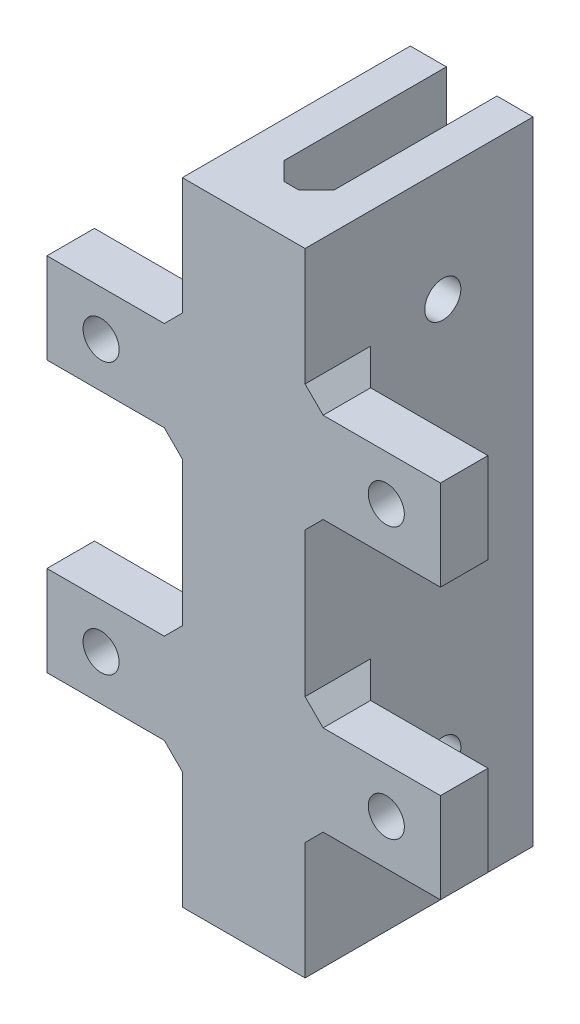
from build123d import *

# Parameters (mm, degrees)
BOSS_EXTRUDE1_DEPTH     = 70
CUT_EXTRUDE1_DEPTH      = 78.776388862
CUT_EXTRUDE1_DEPTH_BACK = 78.776388862
SKETCH2_R               = 2
SKETCH2_W               = 15
SKETCH2_H               = 15
SKETCH2_H_2             = 20
CUT_EXTRUDE2_DEPTH      = 79.217389371
CUT_EXTRUDE2_DEPTH_BACK = 79.217389371
SKETCH3_R               = 2
CHAMFER1_SIZE           = 2


with BuildPart() as part:
    # Sketch1 → Boss-Extrude1 (new body)
    with BuildSketch(Plane(origin=(0, 0, 0), x_dir=(1, 0, 0), z_dir=(0, 1, 0))):
        Polygon((-16.229090909, 0), (-1.229090909, 0), (-1.229090909, 20), (2.770909091, 20), (2.770909091, 0), (8.370909091, 0), (8.370909091, 20), (12.370909091, 20), (12.370909091, 0), (27.370909091, 0), (27.370909091, -5.261218749), (-16.229090909, -5.261218749), align=None)
    extrude(amount=BOSS_EXTRUDE1_DEPTH)

    # Sketch2 → Cut-Extrude1 (cut, two sides: drawn at the far end of the back side and taken through both)
    with BuildSketch(Plane(origin=(0, 0, 0), x_dir=(-1, 0, 0), z_dir=(0, 0, -1)).offset(-CUT_EXTRUDE1_DEPTH_BACK)):
        with Locations((-21.370909091, 50)):
            Circle(SKETCH2_R)
        with Locations((10.229090909, 50)):
            Circle(SKETCH2_R)
        with Locations((10.229090909, 20)):
            Circle(SKETCH2_R)
        with Locations((-21.370909091, 20)):
            Circle(SKETCH2_R)
        with Locations((-19.870909091, 62.5)):
            Rectangle(SKETCH2_W, SKETCH2_H)
        with Locations((-19.870909091, 35)):
            Rectangle(SKETCH2_W, SKETCH2_H_2)
        with Locations((8.729090909, 35)):
            Rectangle(SKETCH2_W, SKETCH2_H_2)
        with Locations((8.729090909, 62.5)):
            Rectangle(SKETCH2_W, SKETCH2_H)
        with Locations((8.729090909, 7.5)):
            Rectangle(SKETCH2_W, SKETCH2_H)
        with Locations((-19.870909091, 7.5)):
            Rectangle(SKETCH2_W, SKETCH2_H)
    extrude(amount=CUT_EXTRUDE1_DEPTH + CUT_EXTRUDE1_DEPTH_BACK, mode=Mode.SUBTRACT)

    # Sketch3 → Cut-Extrude2 (cut, two sides: drawn at the far end of the back side and taken through both)
    with BuildSketch(Plane(origin=(12.370909091, 0, 0), x_dir=(0, 0, -1), z_dir=(1, 0, 0)).offset(-CUT_EXTRUDE2_DEPTH_BACK)):
        with Locations((10, 57.5)):
            Circle(SKETCH3_R)
        with Locations((10, 35.5)):
            Circle(SKETCH3_R)
        with Locations((10, 13.5)):
            Circle(SKETCH3_R)
    extrude(amount=CUT_EXTRUDE2_DEPTH + CUT_EXTRUDE2_DEPTH_BACK, mode=Mode.SUBTRACT)

    # Chamfer1
    chamfer1_edges = [part.edges().sort_by_distance(p)[0] for p in [
        (-1.229090909, 25, 2.630609375),
        (-1.229090909, 20, 0),
        (-1.229090909, 15, 2.630609375),
        (-1.229090909, 45, 2.630609375),
        (-1.229090909, 50, 0),
        (-1.229090909, 55, 2.630609375),
        (12.370909091, 55, 2.630609375),
        (12.370909091, 45, 2.630609375),
        (12.370909091, 50, 0),
        (12.370909091, 15, 2.630609375),
        (12.370909091, 25, 2.630609375),
        (12.370909091, 20, 0),
        (2.770909091, 35, 0),
        (8.370909091, 35, 0),
    ]]
    chamfer(chamfer1_edges, length=CHAMFER1_SIZE)


solid = part.part
